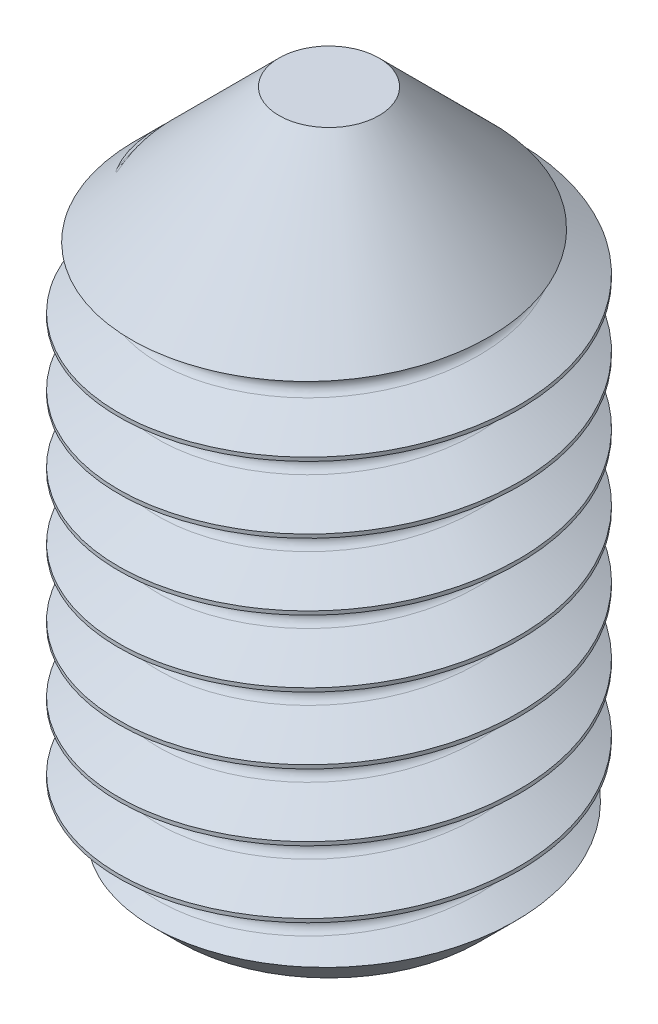
from build123d import *

# Parameters (mm, degrees)
SKETCH1_R           = 1.5
BOSS_EXTRUDE1_DEPTH = 2.5
CUT_EXTRUDE1_DEPTH  = 1.5
CUT_SWEEP1_PITCH    = 0.5


with BuildPart() as part:
    # Sketch1 → Boss-Extrude1 (new, symmetric)
    with BuildSketch(Plane(origin=(0, 0, 0), x_dir=(1, 0, 0), z_dir=(0, 1, 0))):
        with Locations(Location((0, 0, 0), (0, 0, 270))):
            Circle(SKETCH1_R)
    extrude(amount=BOSS_EXTRUDE1_DEPTH, both=True)

    # Sketch2 → Cut-Revolve1 (revolve, cut)
    with BuildSketch(Plane.XY, mode=Mode.PRIVATE) as cut_revolve1_sk:
        Polygon((0.375, 2.5), (2.432389734, 0.442610266), (2.432389734, -1.192610266), (1.125, -2.5), (1.125, -3.907075994), (2.760647944, -3.907075994), (2.760647944, 3.319220543), (0.375, 3.319220543), align=None)
    revolve(cut_revolve1_sk.sketch.rotate(Axis((0, 0, 0), (0, -1, 0)), 270), axis=Axis((0, 0, 0), (0, -1, 0)), mode=Mode.SUBTRACT)

    # Sketch3 → Cut-Extrude1 (cut)
    with BuildSketch(Plane.XZ.offset(2.5)):
        Polygon((0.775, -0.447446459), (0.775, 0.447446459), (0, 0.894892917), (-0.775, 0.447446459), (-0.775, -0.447446459), (0, -0.894892917), align=None)
    extrude(amount=-CUT_EXTRUDE1_DEPTH, mode=Mode.SUBTRACT)

    # Cut-Sweep1: the profile of Sketch5 screwed along a right-hand helix of 10.5 turns, 6 arcs to a turn; built about Z, then put on its axis
    cut_sweep1_z = Axis((0, 0, 0), (0, 0, 1))
    cut_sweep1_corners = [(-1.52303684, 0, 0.203669036), (-1.199115164, 0, 0.016652769), (-1.163040164, 0, -0.045830964), (-1.199115164, 0, -0.108314697), (-1.52303684, 0, -0.295330964)]
    with BuildLine(mode=Mode.PRIVATE) as cut_sweep1_profile:
        Line(cut_sweep1_corners[0], cut_sweep1_corners[1])
        Line(cut_sweep1_corners[3], cut_sweep1_corners[4])
        Line(cut_sweep1_corners[4], cut_sweep1_corners[0])
        ThreePointArc((-1.199115164, 0, 0.016652769), (-1.172706431, 0, -0.009755964), (-1.163040164, 0, -0.045830964))
        ThreePointArc((-1.163040164, 0, -0.045830964), (-1.172706431, 0, -0.081905964), (-1.199115164, 0, -0.108314697))
    cut_sweep1_cap = Face(cut_sweep1_profile.wire())
    cut_sweep1_arcs = [((-1.199115164, 0, 0.016652769), (-1.163040164, 0, -0.004175142), (-1.163040164, 0, -0.045830964), (1, 0.8660254037844412, 1)), ((-1.163040164, 0, -0.045830964), (-1.163040164, 0, -0.087486786), (-1.199115164, 0, -0.108314697), (1, 0.8660254037844412, 1))]  # start, shoulder, end, weights
    cut_sweep1_turn_angles = [0, 30, 60, 90, 120, 150, 180, 210, 240, 270, 300, 330, 360]
    cut_sweep1_turn_weights = [1, 0.8660254037844387, 1, 0.8660254037844387, 1, 0.8660254037844387, 1, 0.8660254037844387, 1, 0.8660254037844387, 1, 0.8660254037844387, 1]
    cut_sweep1_turn_rails = [Edge.make_bspline([Vector(p[0], p[1], 0).rotate(cut_sweep1_z, cut_sweep1_turn_angles[k]) / cut_sweep1_turn_weights[k] + Vector(0, 0, p[2] + CUT_SWEEP1_PITCH * cut_sweep1_turn_angles[k] / 360) for k in range(13)], [0, 0, 0, 1, 1, 2, 2, 3, 3, 4, 4, 5, 5, 6, 6, 6], 2, cut_sweep1_turn_weights) for p in cut_sweep1_corners]
    cut_sweep1_turn_sides = [*[Face.make_surface_from_curves(cut_sweep1_turn_rails[p[0]], cut_sweep1_turn_rails[p[1]]) for p in [(0, 1), (3, 4), (4, 0)]], *[Face.make_bezier_surface([[Vector(p[j][0], p[j][1], 0).rotate(cut_sweep1_z, cut_sweep1_turn_angles[2 * i + k]) / cut_sweep1_turn_weights[2 * i + k] + Vector(0, 0, p[j][2] + CUT_SWEEP1_PITCH * cut_sweep1_turn_angles[2 * i + k] / 360) for k in range(3)] for j in range(3)], [[p[3][j] * cut_sweep1_turn_weights[2 * i + k] for k in range(3)] for j in range(3)]) for p in cut_sweep1_arcs for i in range(6)]]
    cut_sweep1_last_angles = [3600, 3630, 3660, 3690, 3720, 3750, 3780]
    cut_sweep1_last_weights = [1, 0.8660254037844387, 1, 0.8660254037844387, 1, 0.8660254037844188, 1]
    cut_sweep1_last_rails = [Edge.make_bspline([Vector(p[0], p[1], 0).rotate(cut_sweep1_z, cut_sweep1_last_angles[k]) / cut_sweep1_last_weights[k] + Vector(0, 0, p[2] + CUT_SWEEP1_PITCH * cut_sweep1_last_angles[k] / 360) for k in range(7)], [0, 0, 0, 1, 1, 2, 2, 3, 3, 3], 2, cut_sweep1_last_weights) for p in cut_sweep1_corners]
    cut_sweep1_last_sides = [*[Face.make_surface_from_curves(cut_sweep1_last_rails[p[0]], cut_sweep1_last_rails[p[1]]) for p in [(0, 1), (3, 4), (4, 0)]], *[Face.make_bezier_surface([[Vector(p[j][0], p[j][1], 0).rotate(cut_sweep1_z, cut_sweep1_last_angles[2 * i + k]) / cut_sweep1_last_weights[2 * i + k] + Vector(0, 0, p[j][2] + CUT_SWEEP1_PITCH * cut_sweep1_last_angles[2 * i + k] / 360) for k in range(3)] for j in range(3)], [[p[3][j] * cut_sweep1_last_weights[2 * i + k] for k in range(3)] for j in range(3)]) for p in cut_sweep1_arcs for i in range(3)]]
    cut_sweep1 = Plane(origin=(0, -2.5, 0), x_dir=(-1, 0, 0), z_dir=(0, 1, 0)) * Solid(Shell([*[p.moved(Location((0, 0, CUT_SWEEP1_PITCH * i))) for i in range(10) for p in cut_sweep1_turn_sides], *cut_sweep1_last_sides, cut_sweep1_cap, cut_sweep1_cap.rotate(cut_sweep1_z, 3780).moved(Location((0, 0, CUT_SWEEP1_PITCH * 3780 / 360)))]))
    add(cut_sweep1, mode=Mode.SUBTRACT)

    # Cut-Extrude2 cone 1 section (through the dimple's axis) → Cut-Extrude2 (revolve, cut)
    with BuildSketch(Plane(origin=(0, -2.5, 0), x_dir=(0, 0, -1), z_dir=(1, 0, 0))):
        Polygon((0, 0), (0.894892917, 0), (0, 0.239785834), align=None)
    revolve(axis=Axis((0, -2.5, 0), (0, 1, 0)), mode=Mode.SUBTRACT)


solid = part.part
